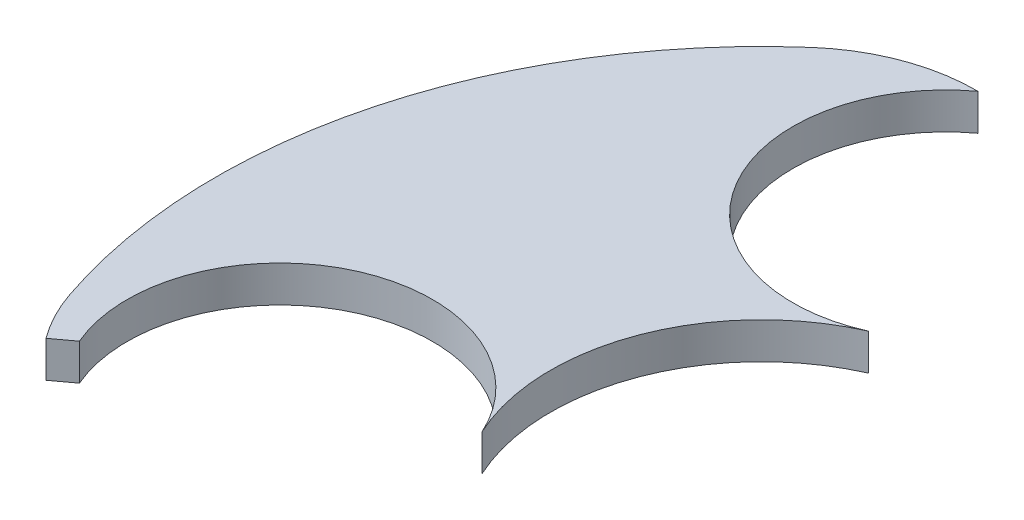
from build123d import *

# Parameters (mm, degrees)
BOSS_EXTRU_1_DEPTH = 5


with BuildPart() as part:
    # Esquisse1 → Boss.-Extru.1 (new body)
    with BuildSketch(Plane(origin=(0, 0, 0), x_dir=(1, 0, 0), z_dir=(0, 1, 0))):
        with BuildLine():
            ThreePointArc((-88.017976153, -38.015428103), (-86.50201361, -41.562295618), (-84.458479206, -44.833744647))
            Line((-84.458479206, -44.833744647), (-81.815842439, -42.884303709))
            ThreePointArc((-81.815842439, -42.884303709), (-70.968463998, -15.424955777), (-43.384090899, -25.950342641))
            ThreePointArc((-43.384090899, -25.950342641), (-44.101640702, -3.667755928), (-28.793147181, 12.539605808))
            ThreePointArc((-28.793147181, 12.539605808), (-55.492491037, 21.154036456), (-49.801969947, 48.625500695))
            ThreePointArc((-49.801969947, 48.625500695), (-58.705793841, 47.051283711), (-66.46729281, 42.41281707))
            ThreePointArc((-66.46729281, 42.41281707), (-89.429119341, 5.46405326), (-88.017976153, -38.015428103))
        make_face()
    extrude(amount=BOSS_EXTRU_1_DEPTH)


solid = part.part
